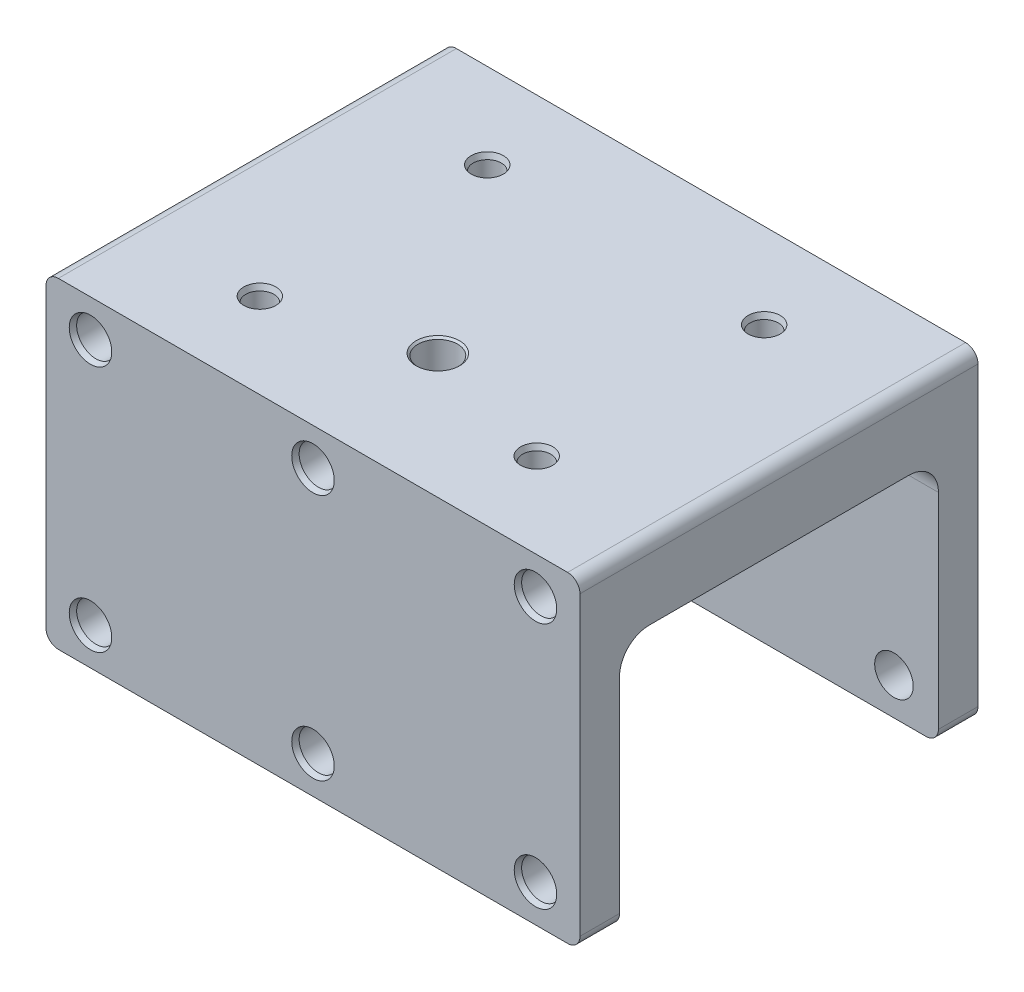
from build123d import *
from OCP.BRepFilletAPI import BRepFilletAPI_MakeChamfer

# Parameters (mm, degrees)
SKETCH1_W           = 108
SKETCH1_H           = 80.5
BOSS_EXTRUDE1_DEPTH = 15
SKETCH2_R           = 3.9
CUT_EXTRUDE1_DEPTH  = 7
SKETCH3_W           = 108
SKETCH3_H           = 50
SKETCH3_R           = 3.9
BOSS_EXTRUDE2_DEPTH = 8
CHAMFER1_SIZE       = 0.4
CHAMFER1_SIZE2      = 1.098990968
FILLET1_R           = 2.5
FILLET2_R           = 6
SKETCH4_R           = 2.85
CUT_EXTRUDE2_DEPTH  = 11
CHAMFER2_SIZE       = 0.4
CHAMFER2_SIZE2      = 1.098990968
SKETCH5_R           = 4
CUT_EXTRUDE3_DEPTH  = 150.563531651
CHAMFER3_SIZE       = 0.4


with BuildPart() as part:
    # Sketch1 → Boss-Extrude1 (new body)
    with BuildSketch(Plane(origin=(0, 0, 0), x_dir=(1, 0, 0), z_dir=(0, 1, 0))):
        with Locations((54, 40.25)):
            Rectangle(SKETCH1_W, SKETCH1_H)
    extrude(amount=BOSS_EXTRUDE1_DEPTH)

    # Sketch2 → Cut-Extrude1 (cut)
    with BuildSketch(Plane.XY):
        with Locations((9, 7.5)):
            Circle(SKETCH2_R)
        with Locations((99, 7.5)):
            Circle(SKETCH2_R)
        with Locations((54, 7.5)):
            Circle(SKETCH2_R)
    cut_extrude1 = extrude(amount=-CUT_EXTRUDE1_DEPTH, mode=Mode.SUBTRACT)

    # Sketch3 → Boss-Extrude2 (add)
    with BuildSketch(Plane.XY):
        with Locations((54, -25)):
            Rectangle(SKETCH3_W, SKETCH3_H)
        with Locations((99, -42.5)):
            Circle(SKETCH3_R, mode=Mode.SUBTRACT)
        with Locations((54, -42.5)):
            Circle(SKETCH3_R, mode=Mode.SUBTRACT)
        with Locations((9, -42.5)):
            Circle(SKETCH3_R, mode=Mode.SUBTRACT)
    boss_extrude2 = extrude(amount=-BOSS_EXTRUDE2_DEPTH)

    # Mirror1: Cut-Extrude1, Boss-Extrude2 across plane
    add(cut_extrude1.mirror(Plane.XY.offset(-40.25)), mode=Mode.SUBTRACT)
    add(boss_extrude2.mirror(Plane.XY.offset(-40.25)))

    # Chamfer1: one chamfer whose edges measure the first distance from different faces: ONE call of the kernel's chamfer builder (chamfer() names one face for all edges)
    chamfer1_edges_1 = [part.edges().sort_by_distance(p)[0] for p in [
        (95.1, 7.5, -80.5),
        (5.1, 7.5, -80.5),
        (50.1, 7.5, -80.5),
        (5.1, -42.5, -80.5),
        (50.1, -42.5, -80.5),
        (95.1, -42.5, -80.5),
    ]]
    chamfer1_side_1 = [part.faces().sort_by_distance(p)[0] for p in [
        (54, -17.5, -80.5),
    ]]
    chamfer1_edges_2 = [part.edges().sort_by_distance(p)[0] for p in [
        (95.1, 7.5, 0),
        (5.1, 7.5, 0),
        (50.1, 7.5, 0),
        (50.1, -42.5, 0),
        (5.1, -42.5, 0),
        (95.1, -42.5, 0),
    ]]
    chamfer1_side_2 = [part.faces().sort_by_distance(p)[0] for p in [
        (54, -17.5, 0),
    ]]
    chamfer1 = BRepFilletAPI_MakeChamfer(part.part.solid().wrapped)
    for e in chamfer1_edges_1:
        chamfer1.Add(CHAMFER1_SIZE, CHAMFER1_SIZE2, e.wrapped, chamfer1_side_1[0].wrapped)  # the first distance lies on this face
    for e in chamfer1_edges_2:
        chamfer1.Add(CHAMFER1_SIZE, CHAMFER1_SIZE2, e.wrapped, chamfer1_side_2[0].wrapped)  # the first distance lies on this face
    add(Compound.cast(chamfer1.Shape()), mode=Mode.REPLACE)

    # Fillet1
    fillet1_edges = [part.edges().sort_by_distance(p)[0] for p in [
        (0, 15, -40.25),
        (108, 15, -40.25),
        (0, -50, -76.5),
        (0, -50, -4),
        (108, -50, -76.5),
        (108, -50, -4),
    ]]
    fillet(fillet1_edges, radius=FILLET1_R)

    # Fillet2
    fillet2_edges = [part.edges().sort_by_distance(p)[0] for p in [
        (54, 0, -72.5),
        (54, 0, -8),
    ]]
    fillet(fillet2_edges, radius=FILLET2_R)

    # Sketch4 → Cut-Extrude2 (cut)
    with BuildSketch(Plane(origin=(0, 15, 0), x_dir=(1, 0, 0), z_dir=(0, 1, 0))):
        with Locations((82, 17.25)):
            Circle(SKETCH4_R)
        with Locations((26, 17.25)):
            Circle(SKETCH4_R)
        with Locations((26, 63.25)):
            Circle(SKETCH4_R)
        with Locations((82, 63.25)):
            Circle(SKETCH4_R)
    extrude(amount=-CUT_EXTRUDE2_DEPTH, mode=Mode.SUBTRACT)

    # Chamfer2
    chamfer2_edges = [part.edges().sort_by_distance(p)[0] for p in [
        (23.15, 15, -63.25),
        (79.15, 15, -63.25),
        (23.15, 15, -17.25),
        (79.15, 15, -17.25),
    ]]
    chamfer2_side = [part.faces().sort_by_distance(p)[0] for p in [
        (54, 15, -40.25),
    ]]
    chamfer(chamfer2_edges, length=CHAMFER2_SIZE, length2=CHAMFER2_SIZE2, reference=chamfer2_side[0])

    # Sketch5 → Cut-Extrude3 (cut, through all)
    with BuildSketch(Plane(origin=(0, 15, 0), x_dir=(1, 0, 0), z_dir=(0, 1, 0))):
        with Locations((54, 25.25)):
            Circle(SKETCH5_R)
    extrude(amount=-CUT_EXTRUDE3_DEPTH, mode=Mode.SUBTRACT)

    # Chamfer3
    chamfer3_edges = [part.edges().sort_by_distance(p)[0] for p in [
        (50, 15, -25.25),
    ]]
    chamfer(chamfer3_edges, length=CHAMFER3_SIZE)


solid = part.part
